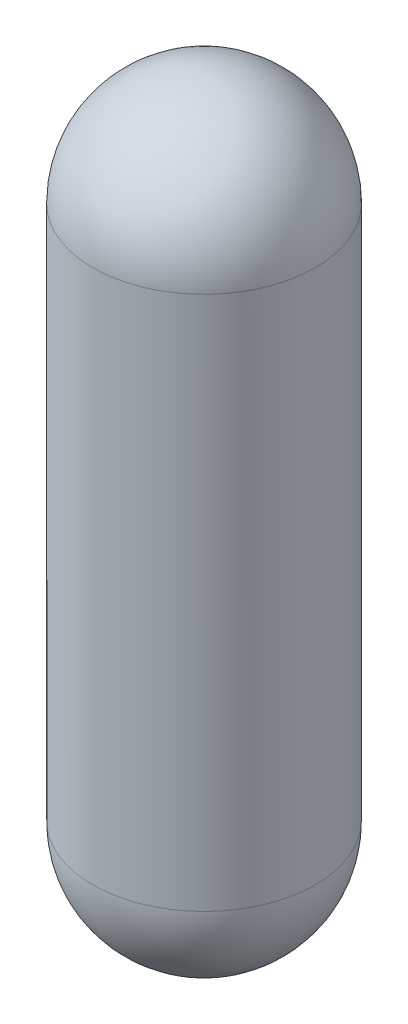
from build123d import *


with BuildPart() as part:
    # Sketch1 → Revolve1 (revolve)
    with BuildSketch(Plane.XY):
        with BuildLine():
            Line((0, 1500), (0, 1812.5))
            ThreePointArc((0, 1812.5), (220.970869121, 1720.970869121), (312.5, 1500))
            Line((312.5, 1500), (312.5, 0))
            ThreePointArc((312.5, 0), (220.970869121, -220.970869121), (0, -312.5))
            Line((0, -312.5), (0, 0))
            Line((0, 0), (0, 1500))
        make_face()
    revolve(axis=Axis((0, 0, 0), (0, 1, 0)))


solid = part.part
